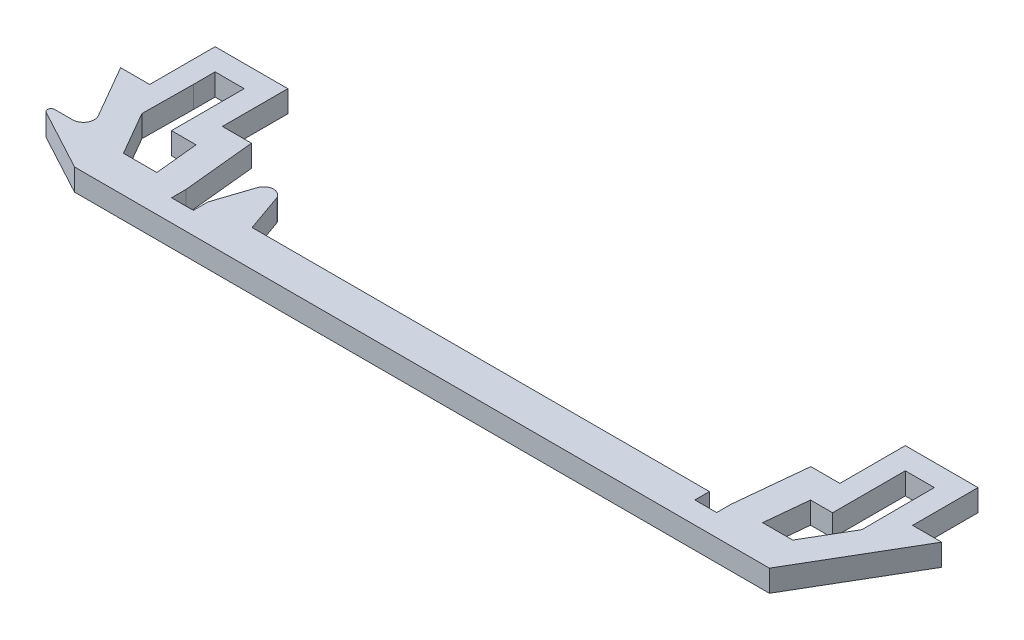
from build123d import *

# Parameters (mm, degrees)
BOSS_EXTRUDE1_DEPTH = 3


with BuildPart() as part:
    # Sketch1 → Boss-Extrude1 (new body)
    with BuildSketch(Plane(origin=(0, 0, 0), x_dir=(1, 0, 0), z_dir=(0, 1, 0))):
        with BuildLine():
            Line((-62.418566214, -47.1586621), (-58.418566214, -47.1586621))
            Line((-58.418566214, -47.1586621), (-58.418566214, -38.1586621))
            Line((-58.418566214, -38.1586621), (-48.418566214, -38.1586621))
            Line((-48.418566214, -38.1586621), (-48.418566214, -47.1586621))
            Line((-48.418566214, -47.1586621), (-44.418566214, -47.1586621))
            Line((-44.418566214, -47.1586621), (-43.418817081, -57.156153425))
            Line((-43.418817081, -57.156153425), (-43.418817081, -59.1586621))
            Line((-43.418817081, -59.1586621), (-40.418817081, -59.1586621))
            Line((-40.418817081, -59.1586621), (-40.418817081, -57.1586621))
            Line((-40.418817081, -57.1586621), (-38.722684913, -52.044656797))
            ThreePointArc((-38.722684913, -52.044656797), (-37.43326006, -51.106013311), (-36.129099744, -52.024073178))
            Line((-36.129099744, -52.024073178), (-34.335191263, -57.1586621))
            Line((-34.335191263, -57.1586621), (28.581433786, -57.1586621))
            Line((28.581433786, -57.1586621), (28.581433786, -59.1586621))
            Line((28.581433786, -59.1586621), (31.581433786, -59.1586621))
            Line((31.581433786, -59.1586621), (31.581433786, -57.208800497))
            Line((31.581433786, -57.208800497), (32.581433786, -47.211334262))
            Line((32.581433786, -47.211334262), (36.581433786, -47.211334262))
            Line((36.581433786, -47.211334262), (36.581433786, -38.211334262))
            Line((36.581433786, -38.211334262), (46.581433786, -38.211334262))
            Line((46.581433786, -38.211334262), (46.581433786, -47.211334262))
            Line((46.581433786, -47.211334262), (50.581433786, -47.211334262))
            Line((50.581433786, -47.211334262), (41.830582941, -62.1586621))
            Line((41.830582941, -62.1586621), (-53.758312176, -62.1586621))
            Line((-53.758312176, -62.1586621), (-62.202371167, -57.610709304))
            ThreePointArc((-62.202371167, -57.610709304), (-62.450096964, -57.048239346), (-61.965274707, -56.670498822))
            Line((-61.965274707, -56.670498822), (-59.524980934, -56.670498822))
            ThreePointArc((-59.524980934, -56.670498822), (-58.225942828, -55.920498822), (-58.225942828, -54.420498822))
            Line((-58.225942828, -54.420498822), (-62.418566214, -47.1586621))
        make_face()
        Polygon((36.547763078, -51.211334262), (39.581433786, -51.211334262), (39.581433786, -44.211334262), (39.581433786, -41.211334262), (43.581433786, -41.211334262), (43.581433786, -44.211334262), (43.604572315, -51.211334262), (40.093380681, -57.208800497), (35.947864455, -57.208800497), align=None, mode=Mode.SUBTRACT)
        Polygon((-55.418566214, -41.1586621), (-51.418566214, -41.1586621), (-51.418566214, -44.1586621), (-51.418566214, -51.1586621), (-48.038516462, -51.1586621), (-47.438516462, -57.1586621), (-52.026261368, -57.1586621), (-55.490362984, -51.1586621), (-55.418566214, -44.1586621), align=None, mode=Mode.SUBTRACT)
    extrude(amount=BOSS_EXTRUDE1_DEPTH)


solid = part.part
